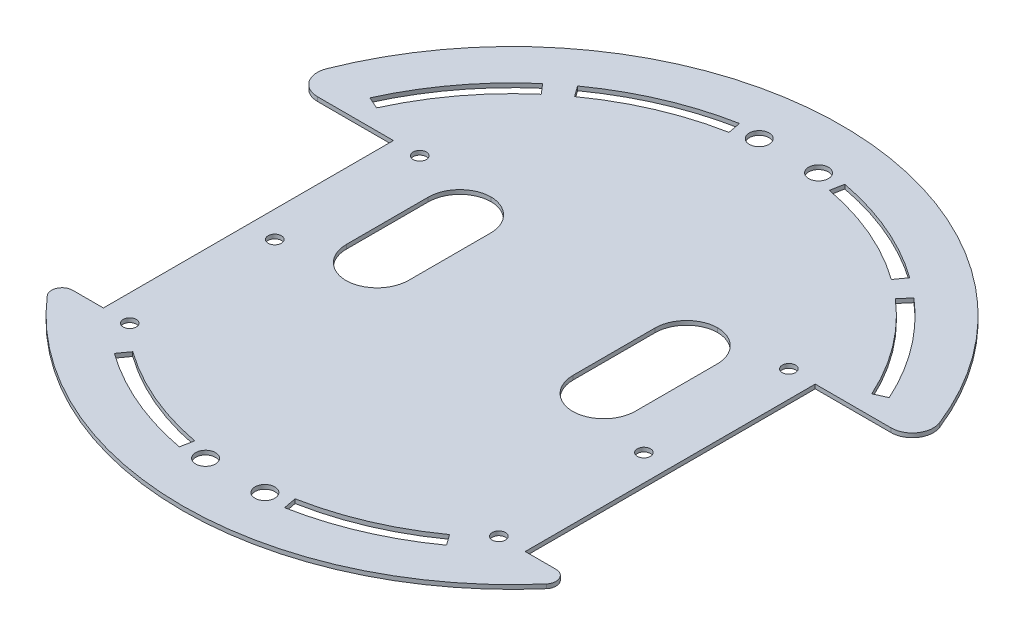
from build123d import *

# Parameters (mm, degrees)
SKETCH1_R           = 1.5875
BOSS_EXTRUDE5_DEPTH = 1.5875
FILLET2_R           = 2.54
FILLET3_R           = 2.54
FILLET4_R           = 5.08
CUT_EXTRUDE1_START  = -2.54
SKETCH2_R           = 2.38125
SKETCH2_R_2         = 1.5875
CUT_EXTRUDE1_DEPTH  = 2.54
SKETCH3_R           = 1.5875
CUT_EXTRUDE2_DEPTH  = 2.54
CUT_EXTRUDE3_DEPTH  = 2.54
SKETCH5_W           = 15
SKETCH5_H           = 34.925
CUT_EXTRUDE4_DEPTH  = 109.650407999
FILLET5_R           = 7.62
FILLET6_R           = 7.62
SKETCH6_R           = 79.375
CUT_EXTRUDE5_DEPTH  = 0.5875


with BuildPart() as part:
    # Sketch1 → Boss-Extrude5 (new body)
    with BuildSketch(Plane(origin=(0, 0, 0), x_dir=(1, 0, 0), z_dir=(0, 1, 0))):
        with BuildLine():
            ThreePointArc((-63.5, -47.625), (-35.497579143, -70.995158286), (0, -79.375))
            ThreePointArc((0, -79.375), (35.497579143, -70.995158286), (63.5, -47.625))
            Line((63.5, -47.625), (50.8, -47.625))
            Line((50.8, -47.625), (50.8, 22.225))
            Line((50.8, 22.225), (76.2, 22.225))
            ThreePointArc((76.2, 22.225), (0, 79.375), (-76.2, 22.225))
            Line((-76.2, 22.225), (-50.8, 22.225))
            Line((-50.8, 22.225), (-50.8, -47.625))
            Line((-50.8, -47.625), (-63.5, -47.625))
        make_face()
        with Locations(Location((-7.14375, -66.675, 0), (0, 0, 270))):
            Circle(SKETCH1_R, mode=Mode.SUBTRACT)
        with BuildLine():
            ThreePointArc((8.73125, -66.675), (7.14375, -68.2625), (5.55625, -66.675))
            ThreePointArc((5.55625, -66.675), (7.14375, -65.0875), (8.73125, -66.675))
        make_face(mode=Mode.SUBTRACT)
        with Locations(Location((-7.14375, 66.675, 0), (0, 0, 270))):
            Circle(SKETCH1_R, mode=Mode.SUBTRACT)
        with Locations(Location((7.14375, 66.675, 0), (0, 0, 270))):
            Circle(SKETCH1_R, mode=Mode.SUBTRACT)
    extrude(amount=BOSS_EXTRUDE5_DEPTH)

    # Fillet2
    fillet2_edges = [part.edges().sort_by_distance(p)[0] for p in [
        (-63.5, 0.79375, 47.625),
    ]]
    fillet(fillet2_edges, radius=FILLET2_R)

    # Fillet3
    fillet3_edges = [part.edges().sort_by_distance(p)[0] for p in [
        (63.5, 0.79375, 47.625),
    ]]
    fillet(fillet3_edges, radius=FILLET3_R)

    # Fillet4
    fillet4_edges = [part.edges().sort_by_distance(p)[0] for p in [
        (-76.2, 0.79375, -22.225),
        (76.2, 0.79375, -22.225),
    ]]
    fillet(fillet4_edges, radius=FILLET4_R)

    # Sketch2 → Cut-Extrude1 (cut)
    # profile 1 of 10: a face of its own
    with BuildSketch(Plane(origin=(0, 1.5875, 0), x_dir=(1, 0, 0), z_dir=(0, 1, 0)).offset(CUT_EXTRUDE1_START)):
        with BuildLine():
            Line((-61.088622125, 27.654457796), (-59.642408406, 26.999765402))
            ThreePointArc((-59.642408406, 26.999765402), (-52.384826382, 39.268743005), (-42.643785254, 49.676068599))
            Line((-42.643785254, 49.676068599), (-43.677815048, 50.880617741))
            Line((-43.677815048, 50.880617741), (-44.711844841, 52.085166883))
            ThreePointArc((-44.711844841, 52.085166883), (-54.925289002, 41.173126022), (-62.534835843, 28.309150189))
            Line((-62.534835843, 28.309150189), (-61.088622125, 27.654457796))
        make_face()
    # profile 2 of 10: a face of its own
    with BuildSketch(Plane(origin=(0, 1.5875, 0), x_dir=(1, 0, 0), z_dir=(0, 1, 0)).offset(CUT_EXTRUDE1_START)):
        with BuildLine():
            Line((-39.077069744, 54.493774041), (-38.151958122, 53.203686937))
            ThreePointArc((-38.151958122, 53.203686937), (-25.732218917, 60.200142208), (-12.092567045, 64.342629994))
            Line((-12.092567045, 64.342629994), (-12.385788543, 65.902815048))
            Line((-12.385788543, 65.902815048), (-12.679010041, 67.463000102))
            ThreePointArc((-12.679010041, 67.463000102), (-26.980132574, 63.119617589), (-40.002181367, 55.783861145))
            Line((-40.002181367, 55.783861145), (-39.077069744, 54.493774041))
        make_face()
    # profile 3 of 10: a face of its own
    with BuildSketch(Plane(origin=(0, 1.5875, 0), x_dir=(1, 0, 0), z_dir=(0, 1, 0)).offset(CUT_EXTRUDE1_START)):
        with Locations(Location((-7.14375, 66.675, 0), (0, 0, 270))):
            Circle(SKETCH2_R)
        with Locations((-7.14375, 66.675)):
            Circle(SKETCH2_R_2, mode=Mode.SUBTRACT)
    # profile 4 of 10: a face of its own
    with BuildSketch(Plane(origin=(0, 1.5875, 0), x_dir=(1, 0, 0), z_dir=(0, 1, 0)).offset(CUT_EXTRUDE1_START)):
        with Locations(Location((7.14375, 66.675, 0), (0, 0, 270))):
            Circle(SKETCH2_R)
        with Locations((7.14375, 66.675)):
            Circle(SKETCH2_R_2, mode=Mode.SUBTRACT)
    # profile 5 of 10: a face of its own
    with BuildSketch(Plane(origin=(0, 1.5875, 0), x_dir=(1, 0, 0), z_dir=(0, 1, 0)).offset(CUT_EXTRUDE1_START)):
        with BuildLine():
            ThreePointArc((12.679010041, 67.463000102), (26.980132574, 63.119617589), (40.002181367, 55.783861145))
            Line((40.002181367, 55.783861145), (39.077069744, 54.493774041))
            Line((39.077069744, 54.493774041), (38.151958122, 53.203686937))
            ThreePointArc((38.151958122, 53.203686937), (25.732218917, 60.200142208), (12.092567045, 64.342629994))
            Line((12.092567045, 64.342629994), (12.385788543, 65.902815048))
            Line((12.385788543, 65.902815048), (12.679010041, 67.463000102))
        make_face()
    # profile 6 of 10: a face of its own
    with BuildSketch(Plane(origin=(0, 1.5875, 0), x_dir=(1, 0, 0), z_dir=(0, 1, 0)).offset(CUT_EXTRUDE1_START)):
        with BuildLine():
            ThreePointArc((44.711844841, 52.085166883), (54.925289002, 41.173126022), (62.534835843, 28.309150189))
            Line((62.534835843, 28.309150189), (59.642408406, 26.999765402))
            ThreePointArc((59.642408406, 26.999765402), (52.384826382, 39.268743005), (42.643785254, 49.676068599))
            Line((42.643785254, 49.676068599), (43.677815048, 50.880617741))
            Line((43.677815048, 50.880617741), (44.711844841, 52.085166883))
        make_face()
    # profile 7 of 10: a face of its own
    with BuildSketch(Plane(origin=(0, 1.5875, 0), x_dir=(1, 0, 0), z_dir=(0, 1, 0)).offset(CUT_EXTRUDE1_START)):
        with BuildLine():
            ThreePointArc((-12.679010041, -67.463000102), (-26.980132574, -63.119617589), (-40.002181367, -55.783861145))
            Line((-40.002181367, -55.783861145), (-39.077069744, -54.493774041))
            Line((-39.077069744, -54.493774041), (-38.151958122, -53.203686937))
            ThreePointArc((-38.151958122, -53.203686937), (-25.732218917, -60.200142208), (-12.092567045, -64.342629994))
            Line((-12.092567045, -64.342629994), (-12.385788543, -65.902815048))
            Line((-12.385788543, -65.902815048), (-12.679010041, -67.463000102))
        make_face()
    # profile 8 of 10: a face of its own
    with BuildSketch(Plane(origin=(0, 1.5875, 0), x_dir=(1, 0, 0), z_dir=(0, 1, 0)).offset(CUT_EXTRUDE1_START)):
        with Locations(Location((-7.14375, -66.675, 0), (0, 0, 270))):
            Circle(SKETCH2_R)
        with Locations((-7.14375, -66.675)):
            Circle(SKETCH2_R_2, mode=Mode.SUBTRACT)
    # profile 9 of 10: a face of its own
    with BuildSketch(Plane(origin=(0, 1.5875, 0), x_dir=(1, 0, 0), z_dir=(0, 1, 0)).offset(CUT_EXTRUDE1_START)):
        with Locations(Location((7.14375, -66.675, 0), (0, 0, 270))):
            Circle(SKETCH2_R)
        with Locations((7.14375, -66.675)):
            Circle(SKETCH2_R_2, mode=Mode.SUBTRACT)
    # profile 10 of 10: a face of its own
    with BuildSketch(Plane(origin=(0, 1.5875, 0), x_dir=(1, 0, 0), z_dir=(0, 1, 0)).offset(CUT_EXTRUDE1_START)):
        with BuildLine():
            ThreePointArc((12.092567045, -64.342629994), (25.732218917, -60.200142208), (38.151958122, -53.203686937))
            Line((38.151958122, -53.203686937), (39.077069744, -54.493774041))
            Line((39.077069744, -54.493774041), (40.002181367, -55.783861145))
            ThreePointArc((40.002181367, -55.783861145), (26.980132574, -63.119617589), (12.679010041, -67.463000102))
            Line((12.679010041, -67.463000102), (12.385788543, -65.902815048))
            Line((12.385788543, -65.902815048), (12.092567045, -64.342629994))
        make_face()
    extrude(amount=CUT_EXTRUDE1_DEPTH, mode=Mode.SUBTRACT)

    # Sketch3 → Cut-Extrude2 (cut)
    with BuildSketch(Plane(origin=(0, 1.5875, 0), x_dir=(1, 0, 0), z_dir=(0, 1, 0))):
        with Locations(Location((-44.45, -47.625, 0), (0, 0, 270))):
            Circle(SKETCH3_R)
        with Locations(Location((-44.45, 22.225, 0), (0, 0, 270))):
            Circle(SKETCH3_R)
        with Locations(Location((44.45, 22.225, 0), (0, 0, 270))):
            Circle(SKETCH3_R)
        with Locations(Location((44.45, -47.625, 0), (0, 0, 270))):
            Circle(SKETCH3_R)
    extrude(amount=-CUT_EXTRUDE2_DEPTH, mode=Mode.SUBTRACT)

    # Sketch4 → Cut-Extrude3 (cut)
    with BuildSketch(Plane(origin=(0, 1.5875, 0), x_dir=(1, 0, 0), z_dir=(0, 1, 0))):
        with BuildLine():
            ThreePointArc((-44.45, -11.1125), (-46.0375, -12.7), (-44.45, -14.2875))
            Line((-44.45, -14.2875), (-44.45, -11.1125))
        make_face()
        with BuildLine():
            Line((-44.45, -11.1125), (-44.45, -14.2875))
            ThreePointArc((-44.45, -14.2875), (-43.327467985, -13.822532015), (-42.8625, -12.7))
            ThreePointArc((-42.8625, -12.7), (-43.327467985, -11.577467985), (-44.45, -11.1125))
        make_face()
        with BuildLine():
            ThreePointArc((44.45, -11.1125), (42.8625, -12.7), (44.45, -14.2875))
            Line((44.45, -14.2875), (44.45, -11.1125))
        make_face()
        with BuildLine():
            Line((44.45, -11.1125), (44.45, -14.2875))
            ThreePointArc((44.45, -14.2875), (45.572532015, -13.822532015), (46.0375, -12.7))
            ThreePointArc((46.0375, -12.7), (45.572532015, -11.577467985), (44.45, -11.1125))
        make_face()
    extrude(amount=-CUT_EXTRUDE3_DEPTH, mode=Mode.SUBTRACT)

    # Sketch5 → Cut-Extrude4 (cut, through all)
    with BuildSketch(Plane(origin=(0, 1.5875, 0), x_dir=(1, 0, 0), z_dir=(0, 1, 0))):
        with Locations((-27.3, 4.7625)):
            Rectangle(SKETCH5_W, SKETCH5_H)
        with Locations((27.3, 4.7625)):
            Rectangle(SKETCH5_W, SKETCH5_H)
    extrude(amount=-CUT_EXTRUDE4_DEPTH, mode=Mode.SUBTRACT)

    # Fillet5
    # the kernel refuses this fillet: 7.62 mm, written as the material it adds along each edge
    with BuildSketch(Plane(origin=(-19.8, 1.5875, 12.7), x_dir=(0, 0, -1), z_dir=(0, -1, 0))) as fillet5_piece_1:
        with BuildLine():
            CenterArc((FILLET5_R, -FILLET5_R), FILLET5_R, 90, 90)
            Line((0, -FILLET5_R), (0, 0))
            Line((0, 0), (FILLET5_R, 0))
        make_face()
    extrude(amount=1.5875)
    with BuildSketch(Plane(origin=(-34.8, 1.5875, 12.7), x_dir=(0, 0, -1), z_dir=(0, -1, 0)), Plane(origin=(-19.8, 1.5875, -22.225), x_dir=(0, 0, 1), z_dir=(0, -1, 0)), Plane(origin=(-34.8, 1.5875, -22.225), x_dir=(1, 0, 0), z_dir=(0, -1, 0))) as fillet5_piece_2:
        with BuildLine():
            CenterArc((FILLET5_R, FILLET5_R), FILLET5_R, 180, 90)
            Line((0, FILLET5_R), (0, 0))
            Line((0, 0), (FILLET5_R, 0))
        make_face()
    extrude(amount=1.5875)

    # Fillet6
    # the kernel refuses this fillet: 7.62 mm, written as the material it adds along each edge
    with BuildSketch(Plane(origin=(34.8, 1.5875, 12.7), x_dir=(0, 0, -1), z_dir=(0, -1, 0)), Plane(origin=(34.8, 1.5875, -22.225), x_dir=(-1, 0, 0), z_dir=(0, -1, 0))) as fillet6_piece_1:
        with BuildLine():
            CenterArc((FILLET6_R, -FILLET6_R), FILLET6_R, 90, 90)
            Line((0, -FILLET6_R), (0, 0))
            Line((0, 0), (FILLET6_R, 0))
        make_face()
    extrude(amount=1.5875)
    with BuildSketch(Plane(origin=(19.8, 1.5875, -22.225), x_dir=(1, 0, 0), z_dir=(0, -1, 0)), Plane(origin=(19.8, 1.5875, 12.7), x_dir=(0, 0, -1), z_dir=(0, -1, 0))) as fillet6_piece_2:
        with BuildLine():
            CenterArc((FILLET6_R, FILLET6_R), FILLET6_R, 180, 90)
            Line((0, FILLET6_R), (0, 0))
            Line((0, 0), (FILLET6_R, 0))
        make_face()
    extrude(amount=1.5875)

    # Sketch6 → Cut-Extrude5 (cut)
    with BuildSketch(Plane(origin=(0, 0, 0), x_dir=(-1, 0, 0), z_dir=(0, -1, 0))):
        Circle(SKETCH6_R)
    extrude(amount=-CUT_EXTRUDE5_DEPTH, mode=Mode.SUBTRACT)


solid = part.part
